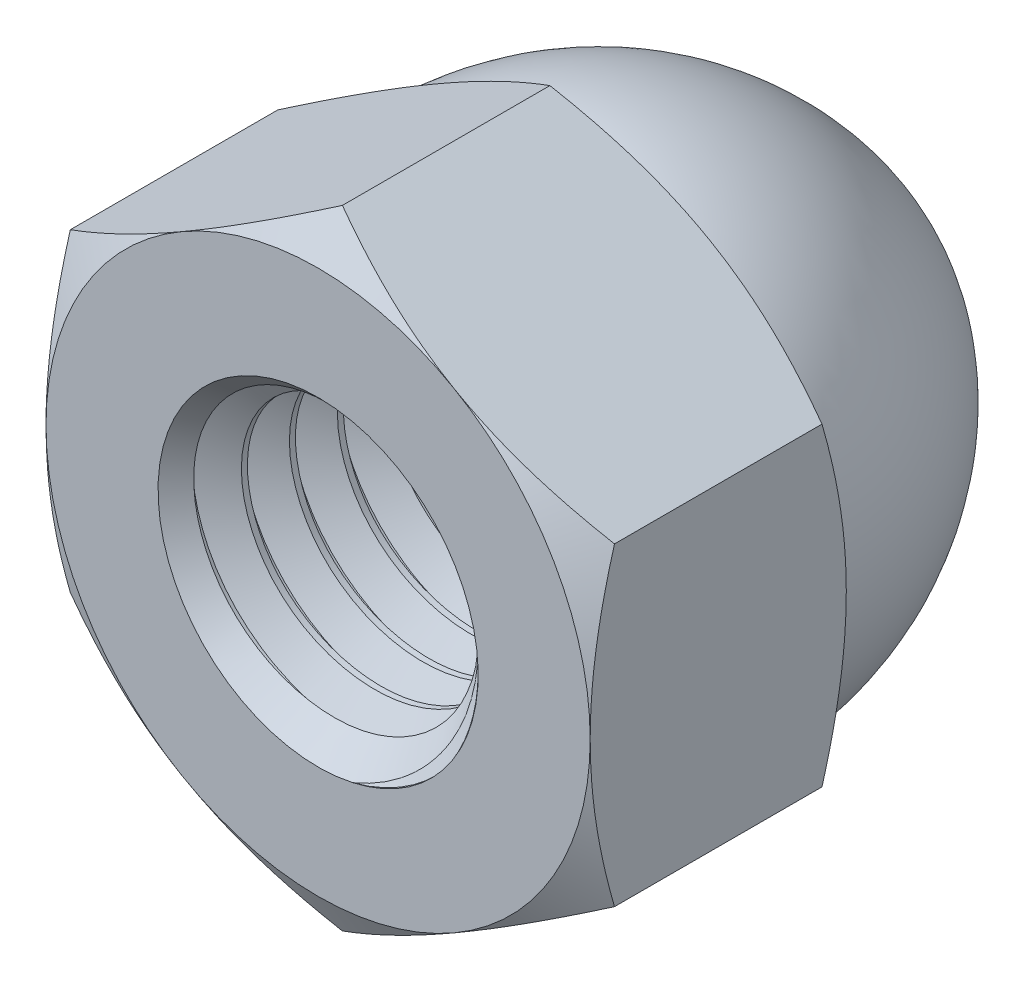
from build123d import *

# Parameters (mm, degrees)
EXTRUDE1_DEPTH     = 8
SKETCH2_OUTSIDE_W  = 80.728
SKETCH2_OUTSIDE_H  = 83.358
SKETCH2_OUTSIDE_R  = 8.5
CUT_EXTRUDE1_DEPTH = 16.250683045
CUT_EXTRUDE1_DRAFT = -60
SKETCH3_OUTSIDE_W  = 80.728
SKETCH3_OUTSIDE_H  = 83.358
SKETCH3_OUTSIDE_R  = 8.5
CUT_EXTRUDE2_DEPTH = 16.250683045
CUT_EXTRUDE2_DRAFT = -60
SKETCH4_R          = 5
CUT_EXTRUDE3_DEPTH = 9.7
SWEEP1_PITCH       = 1.5
CUT_EXTRUDE8_DEPTH = 23.194218586


with BuildPart() as part:
    # Sketch1 → Extrude1 (new body)
    with BuildSketch(Plane.XY):
        Polygon((0, 9.814954576), (-8.5, 4.907477288), (-8.5, -4.907477288), (0, -9.814954576), (8.5, -4.907477288), (8.5, 4.907477288), align=None)
    extrude(amount=-EXTRUDE1_DEPTH)


with BuildPart() as cut_extrude1_tool:
    # Sketch2 outside → Cut-Extrude1 (with draft: the straight prism first)
    with BuildSketch(Plane.XY):
        Rectangle(SKETCH2_OUTSIDE_W, SKETCH2_OUTSIDE_H)
        Circle(SKETCH2_OUTSIDE_R, mode=Mode.SUBTRACT)
    extrude(amount=-CUT_EXTRUDE1_DEPTH)
    # Cut-Extrude1: the draft: its side faces are tilted about the plane it starts from
    cut_extrude1_sides = [cut_extrude1_tool.faces().sort_by_distance(p)[0] for p in [
        (0, -41.679, -8.125341522),
        (40.364, 0, -8.125341522),
        (0, 41.679, -8.125341522),
        (-40.364, 0, -8.125341522),
        (-8.5, 0, -8.125341522),
    ]]
    draft(cut_extrude1_sides, Plane.XY, CUT_EXTRUDE1_DRAFT)


with BuildPart() as part_1:
    add(part.part)

    # Cut-Extrude1: cut by cut_extrude1_tool
    add(cut_extrude1_tool.part, mode=Mode.SUBTRACT)


with BuildPart() as cut_extrude2_tool:
    # Sketch3 outside → Cut-Extrude2 (with draft: the straight prism first)
    with BuildSketch(Plane(origin=(0, 0, -8), x_dir=(-1, 0, 0), z_dir=(0, 0, -1))):
        Rectangle(SKETCH3_OUTSIDE_W, SKETCH3_OUTSIDE_H)
        Circle(SKETCH3_OUTSIDE_R, mode=Mode.SUBTRACT)
    extrude(amount=-CUT_EXTRUDE2_DEPTH)
    # Cut-Extrude2: the draft: its side faces are tilted about the plane it starts from
    cut_extrude2_sides = [cut_extrude2_tool.faces().sort_by_distance(p)[0] for p in [
        (0, -41.679, 0.125341522),
        (-40.364, 0, 0.125341522),
        (0, 41.679, 0.125341522),
        (40.364, 0, 0.125341522),
        (8.5, 0, 0.125341522),
    ]]
    draft(cut_extrude2_sides, Plane(origin=(0, 0, -8), x_dir=(-1, 0, 0), z_dir=(0, 0, -1)), CUT_EXTRUDE2_DRAFT)


with BuildPart() as part_2:
    add(part_1.part)

    # Cut-Extrude2: cut by cut_extrude2_tool
    add(cut_extrude2_tool.part, mode=Mode.SUBTRACT)

    # Sketch14 → Revolve1 (revolve)
    with BuildSketch(Plane(origin=(0, 0, 0), x_dir=(0, 0, -1), z_dir=(1, 0, 0))):
        with BuildLine():
            Line((8, 8.415), (8, 0))
            Line((8, 0), (18, 0))
            ThreePointArc((18, 0), (14.534757551, 6.031335474), (8, 8.415))
        make_face()
    revolve(axis=Axis((0, 0, 0), (0, 0, -1)))

    # Sketch4 → Cut-Extrude3 (cut)
    with BuildSketch(Plane.XY):
        Circle(SKETCH4_R)
    extrude(amount=-CUT_EXTRUDE3_DEPTH, mode=Mode.SUBTRACT)

    # Sweep1: arcs per turn and ends read off the stored shape
    # Sweep1: the profile of Sketch16 profile screwed along a left-hand helix through 8 turns, 6 arcs to a turn; built about Z, then put on its axis
    sweep1_z = Axis((0, 0, 0), (0, 0, 1))
    sweep1_corners = [(5.0003, 0, 0.000173205), (5.0003, 0, -1.312673205), (4.025721421, 0, -0.75), (4.025721421, 0, -0.5625)]
    with BuildLine(mode=Mode.PRIVATE) as sweep1_profile:
        Line(sweep1_corners[0], sweep1_corners[1])
        Line(sweep1_corners[1], sweep1_corners[2])
        Line(sweep1_corners[2], sweep1_corners[3])
        Line(sweep1_corners[3], sweep1_corners[0])
    sweep1_cap = Face(sweep1_profile.wire())
    sweep1_turn_angles = [0, -30, -60, -90, -120, -150, -180, -210, -240, -270, -300, -330, -360]
    sweep1_turn_weights = [1, 0.8660254037844387, 1, 0.8660254037844387, 1, 0.8660254037844387, 1, 0.8660254037844387, 1, 0.8660254037844387, 1, 0.8660254037844387, 1]
    sweep1_turn_rails = [Edge.make_bspline([Vector(p[0], p[1], 0).rotate(sweep1_z, sweep1_turn_angles[k]) / sweep1_turn_weights[k] + Vector(0, 0, p[2] + -SWEEP1_PITCH * sweep1_turn_angles[k] / 360) for k in range(13)], [0, 0, 0, 1, 1, 2, 2, 3, 3, 4, 4, 5, 5, 6, 6, 6], 2, sweep1_turn_weights) for p in sweep1_corners]
    sweep1_turn_sides = [Face.make_surface_from_curves(sweep1_turn_rails[p[0]], sweep1_turn_rails[p[1]]) for p in [(0, 1), (1, 2), (2, 3), (3, 0)]]
    sweep1 = Plane(origin=(0, 0, -9.7), x_dir=(0, 1, 0), z_dir=(0, 0, 1)) * Solid(Shell([*[p.moved(Location((0, 0, SWEEP1_PITCH * i))) for i in range(8) for p in sweep1_turn_sides], sweep1_cap, sweep1_cap.rotate(sweep1_z, -2880).moved(Location((0, 0, -SWEEP1_PITCH * -2880 / 360)))]))
    add(sweep1)

    # Sketch17 → Cut-Extrude8 (cut, through all)
    with BuildSketch(Plane.XY):
        Polygon((0, 9.814954576), (-8.5, 4.907477288), (-8.5, -4.907477288), (0, -9.814954576), (8.5, -4.907477288), (8.5, 4.907477288), align=None)
    extrude(amount=CUT_EXTRUDE8_DEPTH, mode=Mode.SUBTRACT)

    # Cut-Extrude9 cone 1 section (through the dimple's axis) → Cut-Extrude9 (revolve, cut)
    with BuildSketch(Plane(origin=(0, 0, 0), x_dir=(0, -1, 0), z_dir=(1, 0, 0))):
        Polygon((0, 0), (5, 0), (0, 5), align=None)
    revolve(axis=Axis((0, 0, 0), (0, 0, -1)), mode=Mode.SUBTRACT)

    # Sketch20 → Cut-Revolve1 (revolve, cut)
    with BuildSketch(Plane(origin=(0, 0, 0), x_dir=(0, 0, -1), z_dir=(1, 0, 0)), mode=Mode.PRIVATE) as cut_revolve1_sk:
        Polygon((10.2, 5), (13.086751346, 0), (9.7, 0), (9.7, 5), align=None)
    revolve(cut_revolve1_sk.sketch.rotate(Axis((0, 0, 0), (0, 0, 1)), 236.74368395), axis=Axis((0, 0, 0), (0, 0, 1)), mode=Mode.SUBTRACT)


solid = part_2.part
